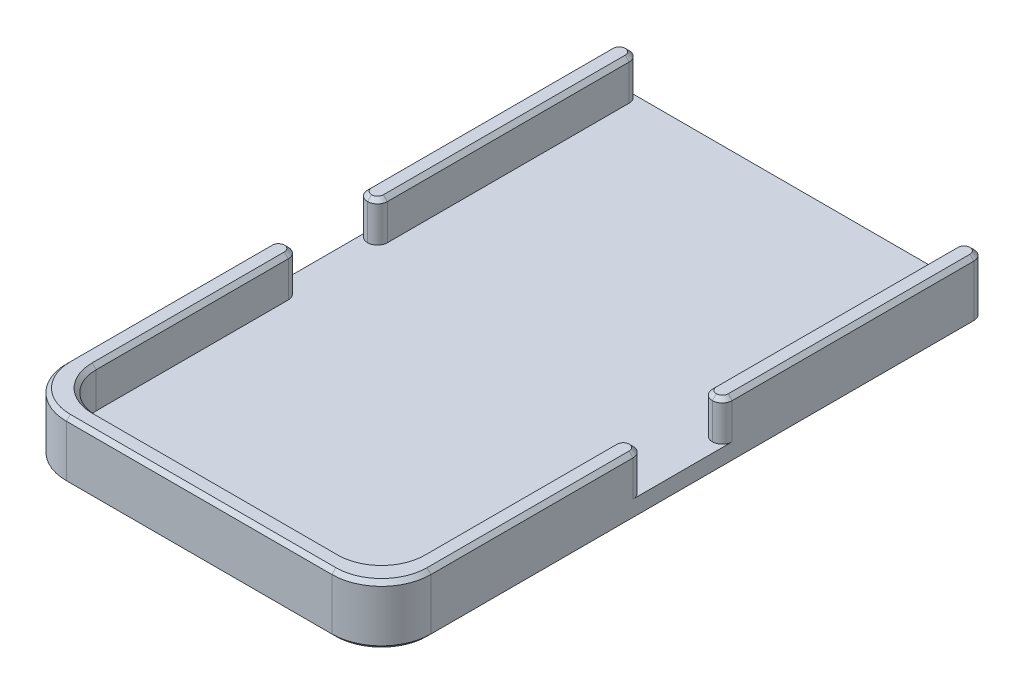
from build123d import *

# Parameters (mm, degrees)
SKETCH1_W           = 58.42
SKETCH1_H           = 96.52
SKETCH1_W_2         = 52.07
SKETCH1_H_2         = 90.17
BOSS_EXTRUDE1_DEPTH = 6.35
SKETCH1_4_W         = 58.42
SKETCH1_4_H         = 96.52
BOSS_EXTRUDE2_DEPTH = 3.175
FILLET1_R           = 6.35
SKETCH4_W           = 52.07
SKETCH4_H           = 20.225419923
CUT_EXTRUDE2_DEPTH  = 6.35
SKETCH5_W           = 78.910757724
SKETCH5_H           = 12.7
CUT_EXTRUDE3_DEPTH  = 6.35
FILLET2_R           = 1.5875
FILLET3_R           = 7.9375
CHAMFER2_SIZE       = 0.635


with BuildPart() as part:
    # Sketch1 → Boss-Extrude1 (new body)
    with BuildSketch(Plane(origin=(0, 0, 0), x_dir=(1, 0, 0), z_dir=(0, 1, 0))):
        Rectangle(SKETCH1_W, SKETCH1_H)
        Rectangle(SKETCH1_W_2, SKETCH1_H_2, mode=Mode.SUBTRACT)
    extrude(amount=BOSS_EXTRUDE1_DEPTH)

    # Sketch1<4> → Boss-Extrude2 (add)
    with BuildSketch(Plane(origin=(0, 0, 0), x_dir=(1, 0, 0), z_dir=(0, 1, 0))):
        Rectangle(SKETCH1_4_W, SKETCH1_4_H)
    extrude(amount=-BOSS_EXTRUDE2_DEPTH)

    # Fillet1
    fillet1_edges = [part.edges().sort_by_distance(p)[0] for p in [
        (26.035, 3.175, 45.085),
        (26.035, 3.175, -45.085),
        (-26.035, 3.175, -45.085),
        (-26.035, 3.175, 45.085),
    ]]
    fillet(fillet1_edges, radius=FILLET1_R)

    # Sketch4 → Cut-Extrude2 (cut)
    with BuildSketch(Plane(origin=(0, 6.35, 0), x_dir=(1, 0, 0), z_dir=(0, 1, 0))):
        with Locations((0, 43.394544924)):
            Rectangle(SKETCH4_W, SKETCH4_H)
    extrude(amount=-CUT_EXTRUDE2_DEPTH, mode=Mode.SUBTRACT)

    # Sketch5 → Cut-Extrude3 (cut)
    with BuildSketch(Plane(origin=(0, 6.35, 0), x_dir=(1, 0, 0), z_dir=(0, 1, 0))):
        Rectangle(SKETCH5_W, SKETCH5_H)
    extrude(amount=-CUT_EXTRUDE3_DEPTH, mode=Mode.SUBTRACT)

    # Fillet2
    fillet2_edges = [part.edges().sort_by_distance(p)[0] for p in [
        (29.21, 3.175, -6.35),
        (-29.21, 3.175, -6.35),
        (26.035, 3.175, -6.35),
        (-26.035, 3.175, -6.35),
        (29.21, 3.175, 6.35),
        (-29.21, 3.175, 6.35),
        (26.035, 3.175, 6.35),
        (-26.035, 3.175, 6.35),
        (-29.21, 1.5875, -48.26),
        (29.21, 1.5875, -48.26),
        (26.035, 3.175, -48.26),
        (-26.035, 3.175, -48.26),
    ]]
    fillet(fillet2_edges, radius=FILLET2_R - 0.0001)  # a hair under: the kernel refuses the full size

    # Fillet3
    fillet3_edges = [part.edges().sort_by_distance(p)[0] for p in [
        (-29.21, 1.5875, 48.26),
        (29.21, 1.5875, 48.26),
    ]]
    fillet(fillet3_edges, radius=FILLET3_R)

    # Chamfer2
    chamfer2_edges = [part.edges().sort_by_distance(p)[0] for p in [
        (29.21, 6.35, -27.305),
        (-29.21, 6.35, 24.12995),
        (-26.035, 6.35, 23.3362),
        (-28.745061304, 6.35, 6.814938696),
        (-26.499938696, 6.35, 6.814938696),
        (26.499938696, 6.35, 6.814938696),
        (28.745061304, 6.35, 6.814938696),
        (26.035, 6.35, -27.305),
        (26.499938696, 6.35, -47.795061304),
        (28.745061304, 6.35, -47.795061304),
        (26.499938696, 6.35, -6.814938696),
        (28.745061304, 6.35, -6.814938696),
        (-29.21, 6.35, -27.305),
        (-26.035, 6.35, -27.305),
        (-26.499938696, 6.35, -47.795061304),
        (-28.745061304, 6.35, -47.795061304),
        (-28.745061304, 6.35, -6.814938696),
        (-26.499938696, 6.35, -6.814938696),
        (0, -3.175, -48.26),
        (-28.745061304, -3.175, -47.795061304),
        (28.745061304, -3.175, -47.795061304),
        (29.21, 6.35, 24.12995),
        (29.21, -3.175, -3.17505),
        (0, -3.175, 48.26),
        (-29.21, -3.175, -3.17505),
        (-26.885160076, -3.175, 45.935160076),
        (26.885160076, -3.175, 45.935160076),
        (0, 6.35, 48.26),
        (-26.885160076, 6.35, 45.935160076),
        (26.885160076, 6.35, 45.935160076),
        (26.035, 6.35, 23.3362),
        (0, 6.35, 45.085),
        (24.175128061, 6.35, 43.225128061),
        (-24.175128061, 6.35, 43.225128061),
    ]]
    chamfer(chamfer2_edges, length=CHAMFER2_SIZE)


solid = part.part
